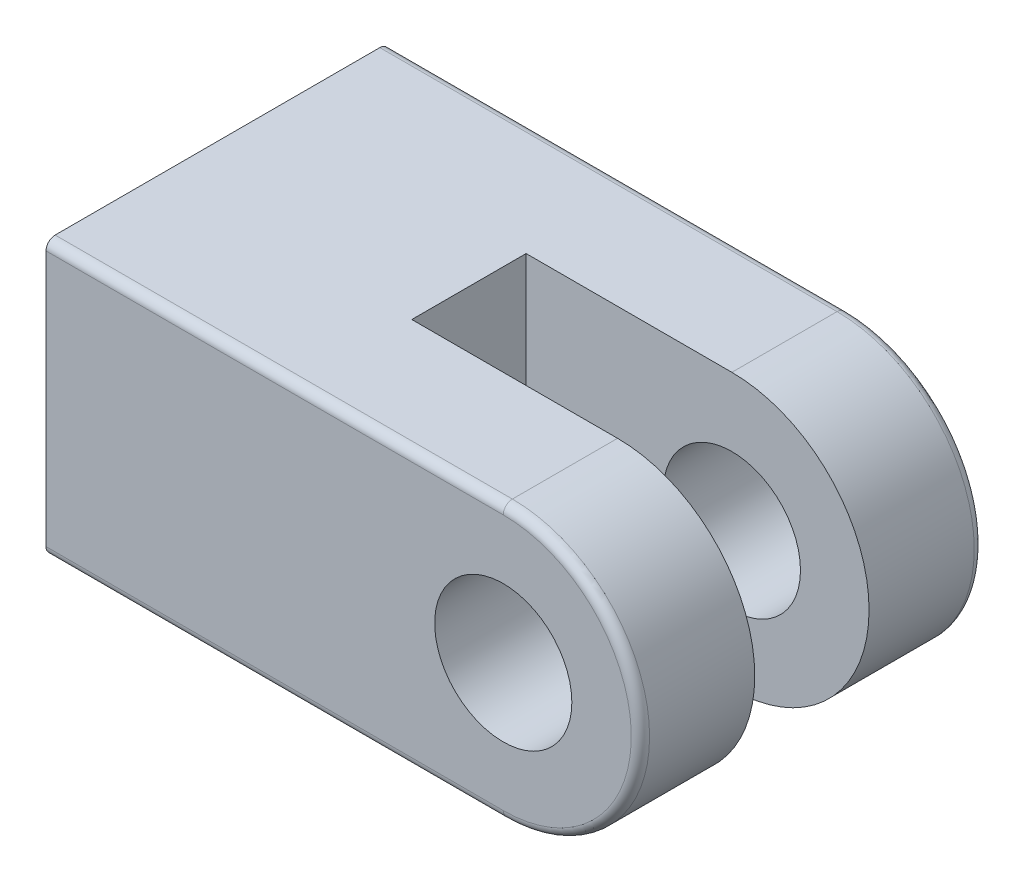
from build123d import *

# Parameters (mm, degrees)
BOSS_EXTRUDE1_DEPTH     = 19.05
CUT_EXTRUDE1_DEPTH      = 33.651598736
CUT_EXTRUDE1_DEPTH_BACK = 33.651598736
SKETCH2_W               = 19.05
SKETCH2_H               = 6.35
SKETCH3_R               = 3.81
CUT_EXTRUDE2_DEPTH      = 33.651598736
FILLET1_START           = -26
FILLET1_DEPTH           = 33.62
FILLET1_2_ANGLE         = 180


with BuildPart() as part:
    # Sketch1 → Boss-Extrude1 (new body)
    with BuildSketch(Plane.XY):
        with BuildLine():
            Line((0, 7.62), (-25.4, 7.62))
            Line((-25.4, 7.62), (-25.4, -7.62))
            Line((-25.4, -7.62), (0, -7.62))
            ThreePointArc((0, -7.62), (7.62, 0), (0, 7.62))
        make_face()
    extrude(amount=BOSS_EXTRUDE1_DEPTH)

    # Sketch2 → Cut-Extrude1 (cut, two sides: drawn at the far end of the back side and taken through both)
    with BuildSketch(Plane(origin=(0, 0, 0), x_dir=(1, 0, 0), z_dir=(0, 1, 0)).offset(-CUT_EXTRUDE1_DEPTH_BACK)):
        with Locations((-1.905, -9.525)):
            Rectangle(SKETCH2_W, SKETCH2_H)
    extrude(amount=CUT_EXTRUDE1_DEPTH + CUT_EXTRUDE1_DEPTH_BACK, mode=Mode.SUBTRACT)

    # Sketch3 → Cut-Extrude2 (cut, through all)
    with BuildSketch(Plane.XY.offset(19.05)):
        Circle(SKETCH3_R)
    extrude(amount=-CUT_EXTRUDE2_DEPTH, mode=Mode.SUBTRACT)

    # Fillet1: read off the stored shape, not the designer's step
    # Fillet1 outline → Fillet1 (cut)
    with BuildSketch(Plane.YZ.offset(FILLET1_START)):
        with BuildLine():
            Line((7.62, 0), (7.62, 0.508))
            ThreePointArc((7.62, 0.508), (7.471210245, 0.148789755), (7.112, 0))
            Line((7.112, 0), (7.62, 0))
        make_face()
        with BuildLine():
            ThreePointArc((7.112, 19.05), (7.471210245, 18.901210245), (7.62, 18.542))
            Line((7.62, 18.542), (7.62, 19.05))
            Line((7.62, 19.05), (7.112, 19.05))
        make_face()
        with BuildLine():
            Line((-7.62, 0), (-7.112, 0))
            ThreePointArc((-7.112, 0), (-7.471210245, 0.148789755), (-7.62, 0.508))
            Line((-7.62, 0.508), (-7.62, 0))
        make_face()
        with BuildLine():
            ThreePointArc((-7.62, 18.542), (-7.471210245, 18.901210245), (-7.112, 19.05))
            Line((-7.112, 19.05), (-7.62, 19.05))
            Line((-7.62, 19.05), (-7.62, 18.542))
        make_face()
    extrude(amount=FILLET1_DEPTH, mode=Mode.SUBTRACT)

    # Fillet1 2 outline → Fillet1 2 (revolve, cut)
    with BuildSketch(Plane(origin=(0, 0, 0), x_dir=(0, -1, 0), z_dir=(-1, 0, 0))):
        with BuildLine():
            ThreePointArc((7.62, 0.508), (7.471210245, 0.148789755), (7.112, 0))
            Line((7.112, 0), (7.62, 0))
            Line((7.62, 0), (7.62, 0.508))
        make_face()
        with BuildLine():
            ThreePointArc((7.112, 19.05), (7.471210245, 18.901210245), (7.62, 18.542))
            Line((7.62, 18.542), (7.62, 19.05))
            Line((7.62, 19.05), (7.112, 19.05))
        make_face()
    revolve(axis=Axis((0, 0, 0), (0, 0, 1)), revolution_arc=FILLET1_2_ANGLE, mode=Mode.SUBTRACT)


solid = part.part
